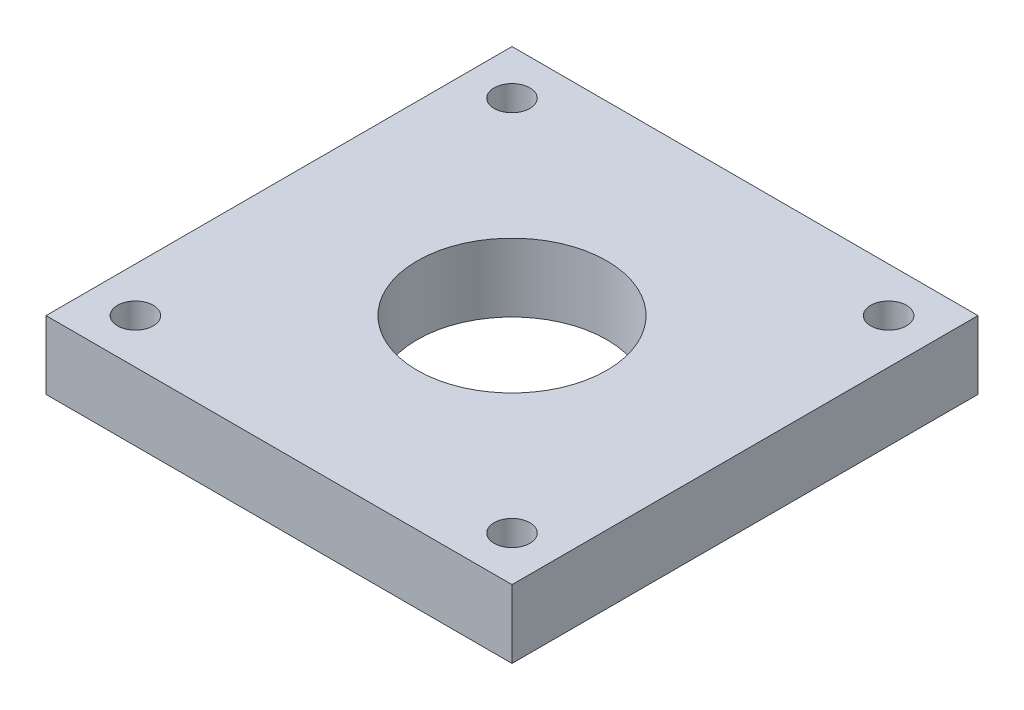
from build123d import *

# Parameters (mm, degrees)
SKETCH1_W           = 86
SKETCH1_H           = 86
SKETCH1_R           = 17.5
BOSS_EXTRUDE1_DEPTH = 12.6
CUT_EXTRUDE1_REACH  = 64.103
SKETCH2_R           = 3.3


with BuildPart() as part:
    # Sketch1 → Boss-Extrude1 (new body)
    with BuildSketch(Plane(origin=(0, 0, 0), x_dir=(1, 0, 0), z_dir=(0, 1, 0))):
        Rectangle(SKETCH1_W, SKETCH1_H)
        Circle(SKETCH1_R, mode=Mode.SUBTRACT)
    extrude(amount=BOSS_EXTRUDE1_DEPTH)

    # Sketch2 → Cut-Extrude1 (cut, up to next)
    with BuildSketch(Plane(origin=(0, 12.6, 0), x_dir=(1, 0, 0), z_dir=(0, 1, 0)), mode=Mode.PRIVATE) as cut_extrude1_sk1:
        with Locations((-34.75, -34.75)):
            Circle(SKETCH2_R)
    cut_extrude1_tool1 = extrude(cut_extrude1_sk1.sketch, amount=-CUT_EXTRUDE1_REACH, mode=Mode.PRIVATE) & part.part
    # Sketch2 → Cut-Extrude1 (cut, up to next)
    with BuildSketch(Plane(origin=(0, 12.6, 0), x_dir=(1, 0, 0), z_dir=(0, 1, 0)), mode=Mode.PRIVATE) as cut_extrude1_sk2:
        with Locations((-34.75, 34.75)):
            Circle(SKETCH2_R)
    cut_extrude1_tool2 = extrude(cut_extrude1_sk2.sketch, amount=-CUT_EXTRUDE1_REACH, mode=Mode.PRIVATE) & part.part
    # Sketch2 → Cut-Extrude1 (cut, up to next)
    with BuildSketch(Plane(origin=(0, 12.6, 0), x_dir=(1, 0, 0), z_dir=(0, 1, 0)), mode=Mode.PRIVATE) as cut_extrude1_sk3:
        with Locations((34.75, -34.75)):
            Circle(SKETCH2_R)
    cut_extrude1_tool3 = extrude(cut_extrude1_sk3.sketch, amount=-CUT_EXTRUDE1_REACH, mode=Mode.PRIVATE) & part.part
    # Sketch2 → Cut-Extrude1 (cut, up to next)
    with BuildSketch(Plane(origin=(0, 12.6, 0), x_dir=(1, 0, 0), z_dir=(0, 1, 0)), mode=Mode.PRIVATE) as cut_extrude1_sk4:
        with Locations((34.75, 34.75)):
            Circle(SKETCH2_R)
    cut_extrude1_tool4 = extrude(cut_extrude1_sk4.sketch, amount=-CUT_EXTRUDE1_REACH, mode=Mode.PRIVATE) & part.part
    add(cut_extrude1_tool1.solids().sort_by_distance((-34.75, 12.6, 34.75))[0], mode=Mode.SUBTRACT)
    add(cut_extrude1_tool2.solids().sort_by_distance((-34.75, 12.6, -34.75))[0], mode=Mode.SUBTRACT)
    add(cut_extrude1_tool3.solids().sort_by_distance((34.75, 12.6, 34.75))[0], mode=Mode.SUBTRACT)
    add(cut_extrude1_tool4.solids().sort_by_distance((34.75, 12.6, -34.75))[0], mode=Mode.SUBTRACT)


solid = part.part
